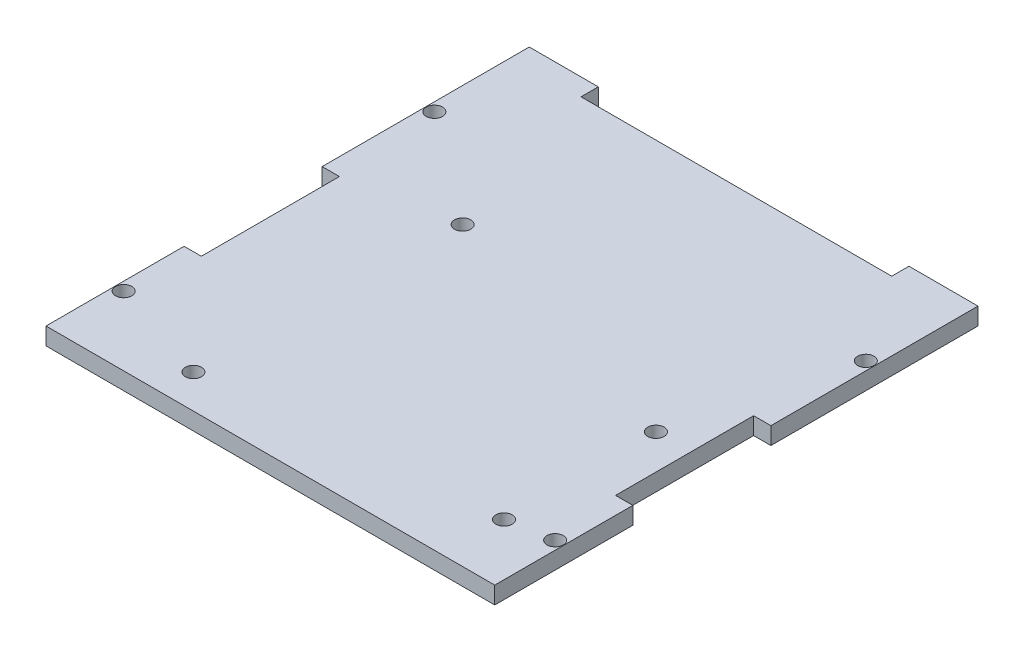
from build123d import *

# Parameters (mm, degrees)
BOSS_EXTRUDE1_DEPTH = 3.175
SKETCH2_R           = 1.5
SKETCH2_R_2         = 1.500000048
CUT_EXTRUDE1_DEPTH  = 99.065877093
SKETCH4_R           = 1.5
CUT_EXTRUDE3_DEPTH  = 99.065877093
SKETCH5_W           = 82.55
SKETCH5_H           = 60.325
CUT_EXTRUDE4_DEPTH  = 99.065877093


with BuildPart() as part:
    # Sketch1 → Boss-Extrude1 (new body)
    with BuildSketch(Plane(origin=(0, 0, 0), x_dir=(1, 0, 0), z_dir=(0, 1, 0))):
        Polygon((-41.275, 0), (-36.368301991, -11.713851401), (-33.466950324, -10.424361771), (-17.857958519, -45.544593333), (-20.759310186, -46.834082962), (-15.601351667, -58.43948963), (-12.7, -60.325), (-5.08, -60.325), (-5.08, -57.15), (5.08, -57.15), (5.08, -60.325), (12.7, -60.325), (15.601351667, -58.43948963), (20.759310186, -46.834082962), (17.857958519, -45.544593333), (33.466950324, -10.424361771), (36.368301991, -11.713851401), (41.275, 0), (41.275, 25.4), (38.1, 25.4), (38.1, 50.8), (41.275, 50.8), (41.275, 88.9), (28.575, 88.9), (28.575, 85.725), (3.175, 85.725), (-3.175, 85.725), (-28.575, 85.725), (-28.575, 88.9), (-41.275, 88.9), (-41.275, 50.8), (-38.1, 50.8), (-38.1, 25.4), (-41.275, 25.4), align=None)
    extrude(amount=BOSS_EXTRUDE1_DEPTH)

    # Sketch2 → Cut-Extrude1 (cut, through all)
    with BuildSketch(Plane(origin=(0, 0, 0), x_dir=(-1, 0, 0), z_dir=(0, -1, 0))):
        with Locations((39.6875, 69.85)):
            Circle(SKETCH2_R)
        with Locations((-8.89, -58.7375)):
            Circle(SKETCH2_R_2)
        with Locations((39.6875, 12.7)):
            Circle(SKETCH2_R_2)
        with Locations((37.496605417, -5.266403252)):
            Circle(SKETCH2_R_2)
        with Locations((16.729655093, -51.992041481)):
            Circle(SKETCH2_R_2)
        with Locations((8.89, -58.7375)):
            Circle(SKETCH2_R_2)
        with Locations((-16.729655093, -51.992041481)):
            Circle(SKETCH2_R_2)
        with Locations((-37.496605417, -5.266403252)):
            Circle(SKETCH2_R_2)
        with Locations((-39.6875, 12.7)):
            Circle(SKETCH2_R_2)
        with Locations((-39.6875, 69.85)):
            Circle(SKETCH2_R)
    extrude(amount=-CUT_EXTRUDE1_DEPTH, mode=Mode.SUBTRACT)

    # Sketch4 → Cut-Extrude3 (cut, through all)
    with BuildSketch(Plane(origin=(0, 3.175, 0), x_dir=(1, 0, 0), z_dir=(0, 1, 0))):
        with Locations((31.681488655, 11.305)):
            Circle(SKETCH4_R)
        with Locations((31.681488655, 39.245)):
            Circle(SKETCH4_R)
        with Locations((-20.388511345, 6.225)):
            Circle(SKETCH4_R)
        with Locations((-19.118511345, 54.485)):
            Circle(SKETCH4_R)
    extrude(amount=-CUT_EXTRUDE3_DEPTH, mode=Mode.SUBTRACT)

    # Sketch5 → Cut-Extrude4 (cut, through all)
    with BuildSketch(Plane(origin=(0, 3.175, 0), x_dir=(1, 0, 0), z_dir=(0, 1, 0))):
        with Locations((0, -30.1625)):
            Rectangle(SKETCH5_W, SKETCH5_H)
    extrude(amount=-CUT_EXTRUDE4_DEPTH, mode=Mode.SUBTRACT)


solid = part.part
